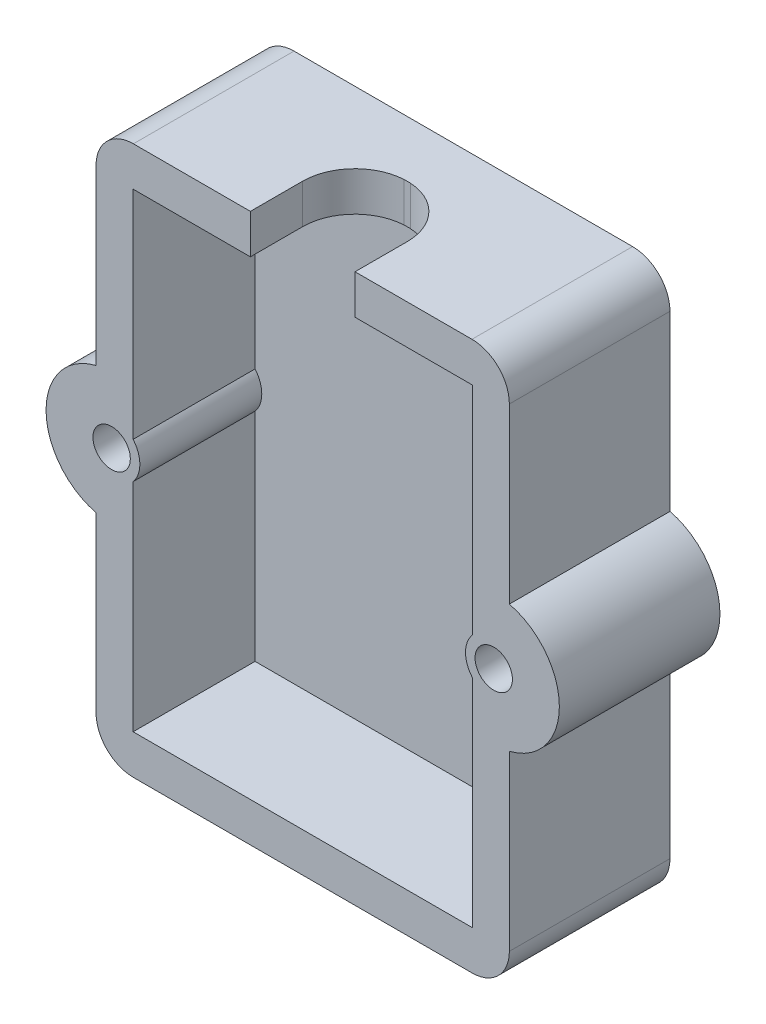
from build123d import *

# Parameters (mm, degrees)
BOSS_EXTRUDE2_DEPTH = 8.595
CUT_EXTRUDE3_REACH  = 33.603
SKETCH5_R           = 1
CUT_EXTRUDE4_DEPTH  = 6.525
CUT_EXTRUDE2_REACH  = 35.54


with BuildPart() as part:
    # Sketch1 → Boss-Extrude2 (new body)
    with BuildSketch(Plane.XY):
        with BuildLine():
            Line((-11.06, -0.233587826), (-11.06, 9.040766215))
            ThreePointArc((-11.06, 9.040766215), (-13.735, 12.45), (-11.06, 15.859233785))
            Line((-11.06, 15.859233785), (-11.06, 25.133587826))
            ThreePointArc((-11.06, 25.133587826), (-10.474213562, 26.547801388), (-9.06, 27.133587826))
            Line((-9.06, 27.133587826), (9.06, 27.133587826))
            ThreePointArc((9.06, 27.133587826), (10.474213562, 26.547801388), (11.06, 25.133587826))
            Line((11.06, 25.133587826), (11.06, 15.859233785))
            ThreePointArc((11.06, 15.859233785), (13.735, 12.45), (11.06, 9.040766215))
            Line((11.06, 9.040766215), (11.06, -0.233587826))
            ThreePointArc((11.06, -0.233587826), (10.474213562, -1.647801388), (9.06, -2.233587826))
            Line((9.06, -2.233587826), (-9.06, -2.233587826))
            ThreePointArc((-9.06, -2.233587826), (-10.474213562, -1.647801388), (-11.06, -0.233587826))
        make_face()
    extrude(amount=BOSS_EXTRUDE2_DEPTH)

    # Sketch5 → Cut-Extrude3 (cut, up to next)
    with BuildSketch(Plane.XY.offset(8.595), mode=Mode.PRIVATE) as cut_extrude3_sk1:
        with Locations((-10.225, 12.45)):
            Circle(SKETCH5_R)
    cut_extrude3_tool1 = extrude(cut_extrude3_sk1.sketch, amount=-CUT_EXTRUDE3_REACH, mode=Mode.PRIVATE) & part.part
    # Sketch5 → Cut-Extrude3 (cut, up to next)
    with BuildSketch(Plane.XY.offset(8.595), mode=Mode.PRIVATE) as cut_extrude3_sk2:
        with Locations((10.225, 12.45)):
            Circle(SKETCH5_R)
    cut_extrude3_tool2 = extrude(cut_extrude3_sk2.sketch, amount=-CUT_EXTRUDE3_REACH, mode=Mode.PRIVATE) & part.part
    add(cut_extrude3_tool1.solids().sort_by_distance((-10.225, 12.45, 8.595))[0], mode=Mode.SUBTRACT)
    add(cut_extrude3_tool2.solids().sort_by_distance((10.225, 12.45, 8.595))[0], mode=Mode.SUBTRACT)

    # Sketch2 → Cut-Extrude4 (cut)
    with BuildSketch(Plane.XY.offset(8.595)):
        with BuildLine():
            Line((-9.075, 13.428570386), (-9.075, 25.025))
            Line((-9.075, 25.025), (9.075, 25.025))
            Line((9.075, 25.025), (9.075, 13.428570386))
            ThreePointArc((9.075, 13.428570386), (8.715, 12.45), (9.075, 11.471429614))
            Line((9.075, 11.471429614), (9.075, -0.125))
            Line((9.075, -0.125), (-9.075, -0.125))
            Line((-9.075, -0.125), (-9.075, 11.471429614))
            ThreePointArc((-9.075, 11.471429614), (-8.715, 12.45), (-9.075, 13.428570386))
        make_face()
    extrude(amount=-CUT_EXTRUDE4_DEPTH, mode=Mode.SUBTRACT)

    # Sketch3 → Cut-Extrude2 (cut, up to next)
    with BuildSketch(Plane(origin=(0, 27.133587826, 0), x_dir=(1, 0, 0), z_dir=(0, 1, 0)), mode=Mode.PRIVATE) as cut_extrude2_sk1:
        with BuildLine():
            Line((0.167257287, -3.005), (-0.167257287, -3.005))
            ThreePointArc((-0.167257287, -3.005), (-2.038175704, -3.880145891), (-2.8, -5.8))
            Line((-2.8, -5.8), (-2.8, -8.595))
            Line((-2.8, -8.595), (-0.167257287, -8.595))
            Line((-0.167257287, -8.595), (0.167257287, -8.595))
            Line((0.167257287, -8.595), (2.8, -8.595))
            Line((2.8, -8.595), (2.8, -5.8))
            ThreePointArc((2.8, -5.8), (2.038175704, -3.880145891), (0.167257287, -3.005))
        make_face()
    cut_extrude2_tool1 = extrude(cut_extrude2_sk1.sketch, amount=-CUT_EXTRUDE2_REACH, mode=Mode.PRIVATE) & part.part
    add(cut_extrude2_tool1.solids().sort_by_distance((0, 27.133588, 6.058962))[0], mode=Mode.SUBTRACT)


solid = part.part
